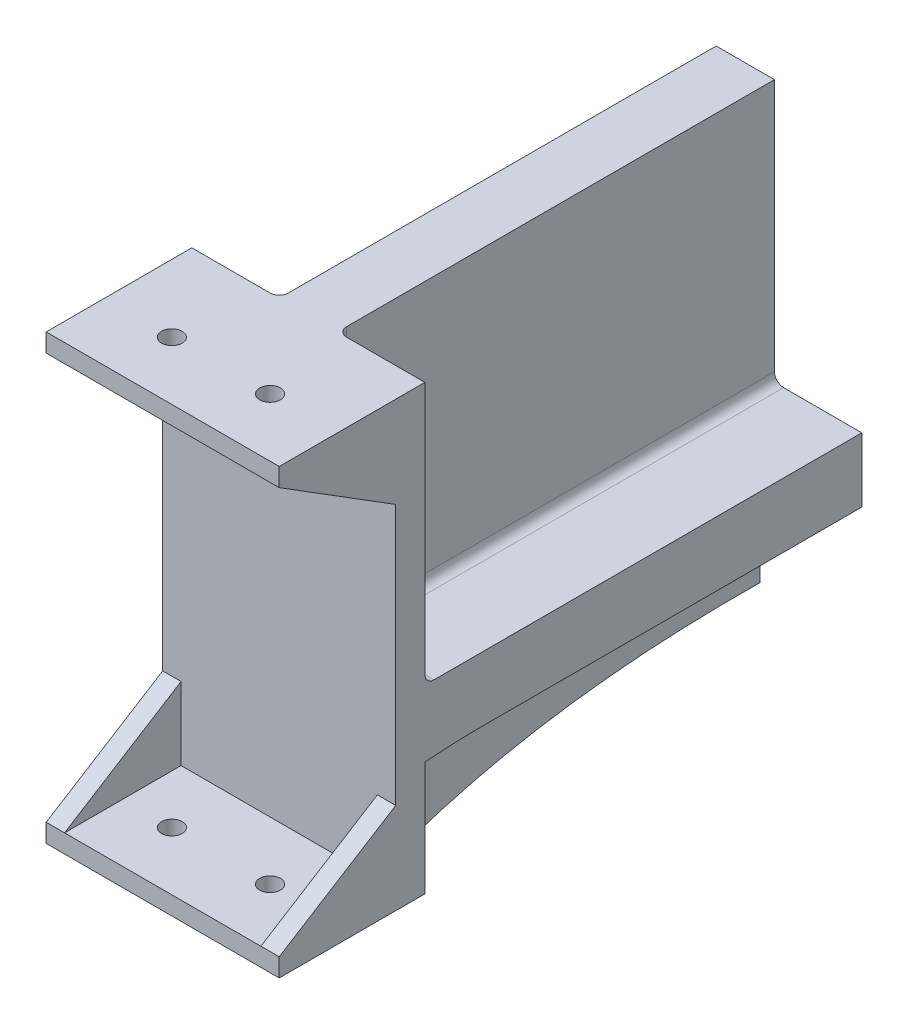
from build123d import *

# Parameters (mm, degrees)
SKETCH1_W               = 50.8
SKETCH1_H               = 96.5708
BOSS_EXTRUDE1_DEPTH     = 101.6
CUT_EXTRUDE1_DEPTH      = 143.455745453
CUT_EXTRUDE1_DEPTH_BACK = 25.4
FILLET1_R               = 12.7
FILLET2_R               = 12.7
SKETCH4_W               = 50.8
SKETCH4_H               = 4
BOSS_EXTRUDE2_DEPTH     = 25.4
BOSS_EXTRUDE3_DEPTH     = 4
M4_CLEARANCE_HOLE1_D    = 4.5
MIRROR2_COPY_1_DEPTH    = 4
SKETCH10_W              = 19.05
SKETCH10_H              = 57.15
CUT_EXTRUDE2_DEPTH      = 95.25
FILLET3_R               = 2


with BuildPart() as part:
    # Sketch1 → Boss-Extrude1 (new body)
    with BuildSketch(Plane.XY):
        Rectangle(SKETCH1_W, SKETCH1_H)
    extrude(amount=BOSS_EXTRUDE1_DEPTH)

    # Sketch2 → Cut-Extrude1 (cut, two sides: drawn at the far end of the back side and taken through both)
    with BuildSketch(Plane.XZ.offset(48.2854).offset(-CUT_EXTRUDE1_DEPTH_BACK)):
        with BuildLine():
            Line((-25.4, 0), (-3.175, 0))
            ThreePointArc((-3.175, 0), (-6.041573742, 48.089456834), (-15.875, 95.25))
            Line((-15.875, 95.25), (-25.4, 95.25))
            Line((-25.4, 95.25), (-25.4, 0))
        make_face()
        with BuildLine():
            ThreePointArc((15.875, 95.25), (6.041573742, 48.089456834), (3.175, 0))
            Line((3.175, 0), (25.4, 0))
            Line((25.4, 0), (25.4, 95.25))
            Line((25.4, 95.25), (15.875, 95.25))
        make_face()
    extrude(amount=CUT_EXTRUDE1_DEPTH + CUT_EXTRUDE1_DEPTH_BACK, mode=Mode.SUBTRACT)

    # Fillet1
    fillet1_edges = [part.edges().sort_by_distance(p)[0] for p in [
        (6.041573742, -22.8854, 48.089456834),
        (-6.041573742, -22.8854, 48.089456834),
    ]]
    fillet(fillet1_edges, radius=FILLET1_R)

    # Fillet2
    # the kernel refuses this fillet: 12.7 mm, written as the material it adds along each edge
    with BuildSketch(Plane(origin=(-15.875, -48.2854, 95.25), x_dir=(-1, 0, 0), z_dir=(0, 1, 0))) as fillet2_piece_1:
        with BuildLine():
            CenterArc((9.726246489, -12.698405406), FILLET2_R, 90.90795725, 74.851551617)
            Line((-2.583504713, -9.57430148), (-2.829699737, -9.511819402))
            ThreePointArc((-2.829699737, -9.511819402), (-1.57292596, -4.711279583), (-0.244207713, 0.069846926))
            Line((-0.244207713, 0.069846926), (0, 0.254))
            ThreePointArc((0, 0.254), (4.7625, 0.254), (9.52097507, 0.253968108))
            Line((9.52097507, 0.253968108), (9.525, 0))
        make_face()
    extrude(amount=37.491851666)
    with BuildSketch(Plane(origin=(15.875, -48.2854, 95.25), x_dir=(1, 0, 0), z_dir=(0, 1, 0))) as fillet2_piece_2:
        with BuildLine():
            CenterArc((9.726246489, 12.698405406), FILLET2_R, 194.240491133, 74.851551617)
            Line((-2.583504713, 9.57430148), (-2.829699737, 9.511819402))
            ThreePointArc((-2.829699737, 9.511819402), (-1.57292596, 4.711279583), (-0.244207713, -0.069846926))
            Line((-0.244207713, -0.069846926), (0, -0.254))
            ThreePointArc((0, -0.254), (4.7625, -0.254), (9.52097507, -0.253968108))
            Line((9.52097507, -0.253968108), (9.525, 0))
        make_face()
    extrude(amount=37.491851666)

    # Sketch4 → Boss-Extrude2 (add)
    with BuildSketch(Plane.XY.offset(101.6)):
        with Locations((0, -46.2854)):
            Rectangle(SKETCH4_W, SKETCH4_H)
    boss_extrude2 = extrude(amount=BOSS_EXTRUDE2_DEPTH)

    # Sketch5 → Boss-Extrude3 (add)
    with BuildSketch(Plane(origin=(25.4, 0, 0), x_dir=(0, 0, -1), z_dir=(1, 0, 0))):
        Polygon((-101.6, -28.4104), (-127, -44.2854), (-101.6, -44.2854), align=None)
    boss_extrude3 = extrude(amount=-BOSS_EXTRUDE3_DEPTH)

    # Mirror1: Boss-Extrude3 across plane
    add(boss_extrude3.mirror(Plane(origin=(0, 0, 0), x_dir=(0, 0, 1), z_dir=(1, 0, 0))))

    # M4 Clearance Hole1 (through all)
    with Locations(Plane(origin=(0, -44.2854, 0), x_dir=(1, 0, 0), z_dir=(0, 1, 0))):
        with Locations((-10.7, -114.3), (10.7, -114.3)):
            m4_clearance_hole1 = Hole(M4_CLEARANCE_HOLE1_D / 2)

    # Mirror2: Boss-Extrude2, Boss-Extrude3, M4 Clearance Hole1 across plane
    add(boss_extrude2.mirror(Plane.ZX))
    add(boss_extrude3.mirror(Plane.ZX))
    add(m4_clearance_hole1.mirror(Plane.ZX), mode=Mode.SUBTRACT)

    # Mirror2 copy 1 sketch → Mirror2 copy 1 (add)
    with BuildSketch(Plane(origin=(-25.4, 0, 0), x_dir=(0, 0, -1), z_dir=(-1, 0, 0))):
        Polygon((-101.6, -28.4104), (-127, -44.2854), (-101.6, -44.2854), align=None)
    extrude(amount=-MIRROR2_COPY_1_DEPTH)

    # Sketch10 → Cut-Extrude2 (cut)
    with BuildSketch(Plane(origin=(0, 0, 0), x_dir=(-1, 0, 0), z_dir=(0, 0, -1))):
        with Locations((-15.875, 19.7104)):
            Rectangle(SKETCH10_W, SKETCH10_H)
        with Locations((15.875, 19.7104)):
            Rectangle(SKETCH10_W, SKETCH10_H)
    extrude(amount=-CUT_EXTRUDE2_DEPTH, mode=Mode.SUBTRACT)

    # Fillet3
    fillet3_edges = [part.edges().sort_by_distance(p)[0] for p in [
        (6.35, -8.8646, 47.625),
        (6.35, 19.7104, 95.25),
        (15.875, -8.8646, 95.25),
        (-6.35, -8.8646, 47.625),
        (-15.875, -8.8646, 95.25),
        (-6.35, 19.7104, 95.25),
    ]]
    fillet(fillet3_edges, radius=FILLET3_R)


solid = part.part
